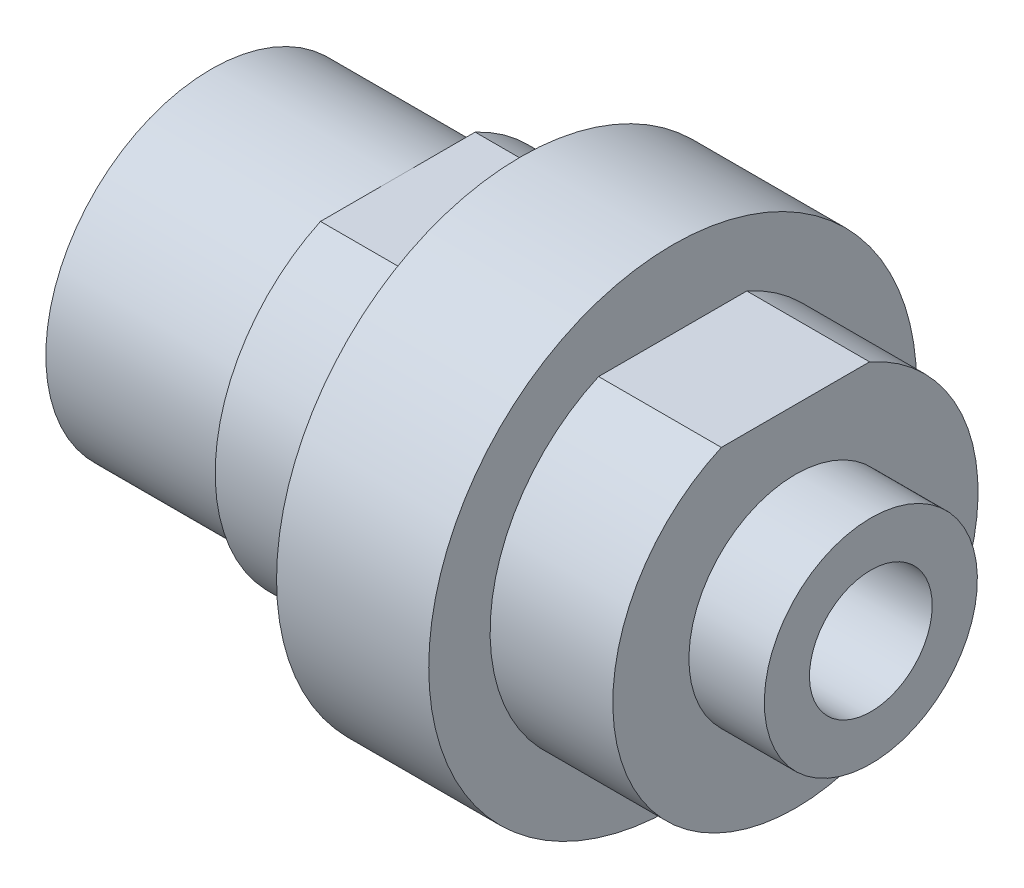
from build123d import *

# Parameters (mm, degrees)
CUT_EXTRUDE1_DEPTH      = 39.514968698
CUT_EXTRUDE1_DEPTH_BACK = 39.514968698
SKETCH2_W               = 6.35
SKETCH2_H               = 0.889
SKETCH2_H_2             = 0.8128


with BuildPart() as part:
    # Sketch1 → Revolve1 (revolve)
    with BuildSketch(Plane.XY):
        Polygon((0, 8.5598), (0, 3.175), (34.12744, 3.175), (34.12744, 5.5118), (30.226, 5.5118), (30.226, 9.4488), (23.876, 9.4488), (23.876, 12.6238), (16.002, 12.6238), (16.002, 9.4488), (9.652, 9.4488), (9.652, 8.5598), align=None)
    revolve(axis=Axis((34.12744, 0, 0), (-1, 0, 0)))

    # Sketch2 → Cut-Extrude1 (cut, two sides: drawn at the far end of the back side and taken through both)
    with BuildSketch(Plane.XY.offset(-CUT_EXTRUDE1_DEPTH_BACK)):
        with Locations((12.827, 9.0043)):
            Rectangle(SKETCH2_W, SKETCH2_H)
        with Locations((27.051, 9.0424)):
            Rectangle(SKETCH2_W, SKETCH2_H_2)
    extrude(amount=CUT_EXTRUDE1_DEPTH + CUT_EXTRUDE1_DEPTH_BACK, mode=Mode.SUBTRACT)


solid = part.part
